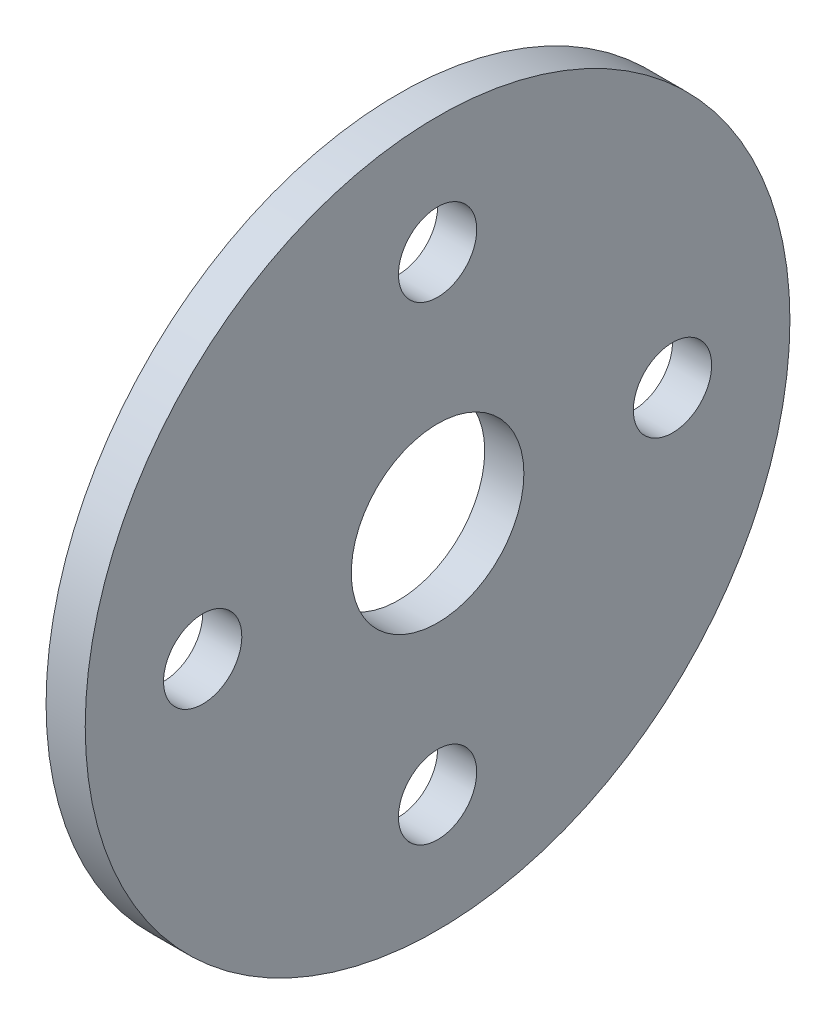
from build123d import *

# Parameters (mm, degrees)
SKETCH1_R           = 28.575
SKETCH1_R_2         = 6.99897
BOSS_EXTRUDE1_DEPTH = 3.175
SKETCH2_R           = 3.175
CUT_EXTRUDE1_DEPTH  = 41.535686438
CIRPATTERN1_COUNT   = 4


with BuildPart() as part:
    # Sketch1 → Boss-Extrude1 (new body)
    with BuildSketch(Plane(origin=(0, 0, 0), x_dir=(0, 0, -1), z_dir=(1, 0, 0))):
        Circle(SKETCH1_R)
        Circle(SKETCH1_R_2, mode=Mode.SUBTRACT)
    extrude(amount=BOSS_EXTRUDE1_DEPTH)

    # Sketch2 → Cut-Extrude1 (cut, through all)
    with BuildSketch(Plane(origin=(0, 0, 0), x_dir=(0, 0, -1), z_dir=(1, 0, 0))):
        with Locations((0, 19.05)):
            Circle(SKETCH2_R)
    cut_extrude1 = extrude(amount=CUT_EXTRUDE1_DEPTH, mode=Mode.SUBTRACT)

    # CirPattern1: Cut-Extrude1 ×4 about axis
    cirpattern1_axis = Axis((3.175, 0, 0), (1, 0, 0))
    for i in range(1, CIRPATTERN1_COUNT):
        add(cut_extrude1.rotate(cirpattern1_axis, i * 360 / CIRPATTERN1_COUNT), mode=Mode.SUBTRACT)


solid = part.part
